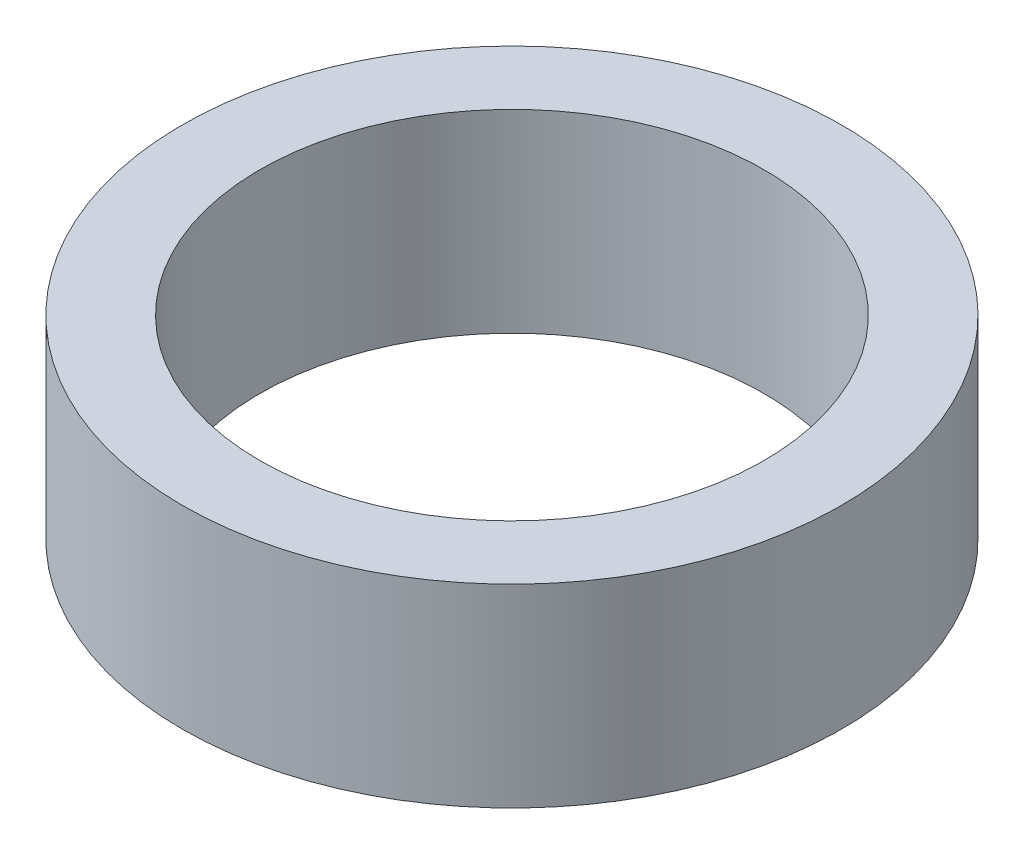
from build123d import *

# Parameters (mm, degrees)
SKETCH1_R           = 42.5
BOSS_EXTRUDE1_DEPTH = 25
SKETCH2_R           = 32.5
CUT_EXTRUDE1_DEPTH  = 66.096082831


with BuildPart() as part:
    # Sketch1 → Boss-Extrude1 (new body)
    with BuildSketch(Plane(origin=(0, 0, 0), x_dir=(1, 0, 0), z_dir=(0, 1, 0))):
        Circle(SKETCH1_R)
    extrude(amount=BOSS_EXTRUDE1_DEPTH)

    # Sketch2 → Cut-Extrude1 (cut, through all)
    with BuildSketch(Plane(origin=(0, 0, 0), x_dir=(1, 0, 0), z_dir=(0, 1, 0))):
        Circle(SKETCH2_R)
    extrude(amount=CUT_EXTRUDE1_DEPTH, mode=Mode.SUBTRACT)


solid = part.part
